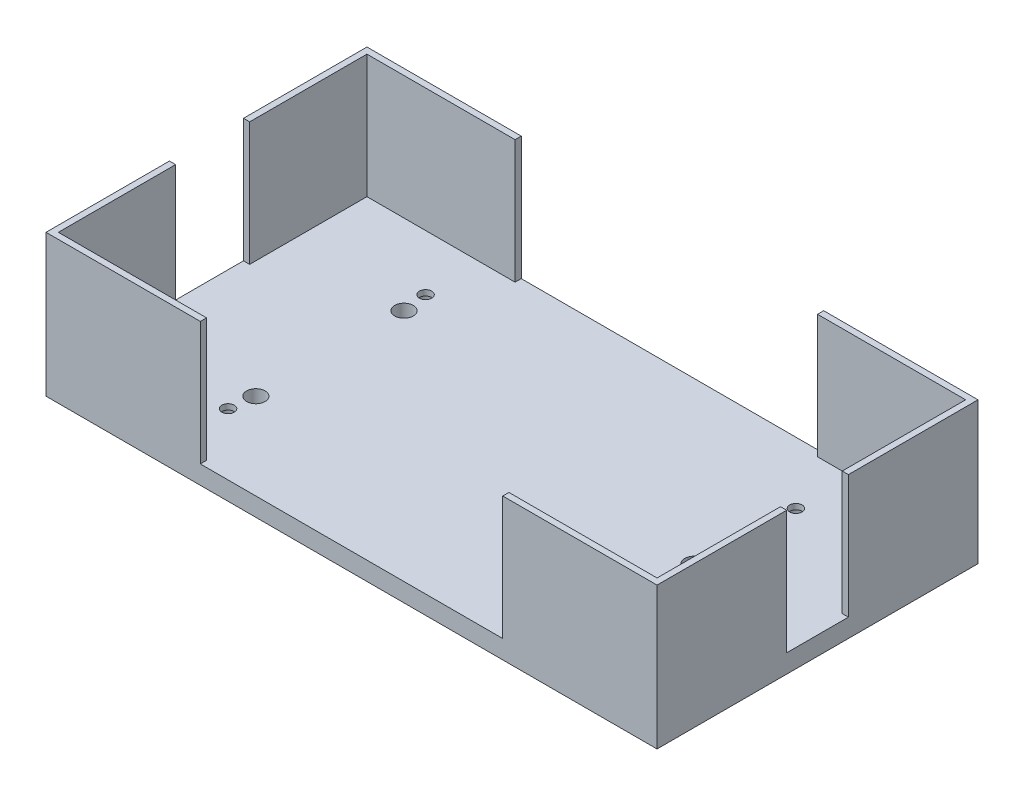
from build123d import *

# Parameters (mm, degrees)
SKETCH1_W           = 99
SKETCH1_H           = 52
BOSS_EXTRUDE1_DEPTH = 3
SKETCH5_R           = 1.5
CUT_EXTRUDE3_DEPTH  = 72.961470153
BOSS_EXTRUDE3_DEPTH = 20
SKETCH7_R           = 1
CUT_EXTRUDE4_DEPTH  = 75.628769162
SKETCH8_R           = 1.85
CUT_EXTRUDE5_DEPTH  = 2.1


with BuildPart() as part:
    # Sketch1 → Boss-Extrude1 (new body)
    with BuildSketch(Plane(origin=(0, 0, 0), x_dir=(1, 0, 0), z_dir=(0, 1, 0))):
        with Locations((-10.729105331, -13.267137121)):
            Rectangle(SKETCH1_W, SKETCH1_H)
    extrude(amount=BOSS_EXTRUDE1_DEPTH)

    # Sketch5 → Cut-Extrude3 (cut, through all)
    with BuildSketch(Plane(origin=(0, 3, 0), x_dir=(1, 0, 0), z_dir=(0, 1, 0))):
        with Locations((-40.229105331, -25.267137121)):
            Circle(SKETCH5_R)
        with Locations((-40.229105331, -1.267137121)):
            Circle(SKETCH5_R)
        with Locations((18.770894669, -13.267137121)):
            Circle(SKETCH5_R)
    extrude(amount=-CUT_EXTRUDE3_DEPTH, mode=Mode.SUBTRACT)

    # Sketch6 → Boss-Extrude3 (add)
    with BuildSketch(Plane(origin=(0, 3, 0), x_dir=(1, 0, 0), z_dir=(0, 1, 0))):
        Polygon((-60.229105331, -19.267137121), (-60.229105331, -39.267137121), (-35.229105331, -39.267137121), (-35.229105331, -38.267137121), (-59.229105331, -38.267137121), (-59.229105331, -19.267137121), align=None)
        Polygon((38.770894669, -18.267137121), (37.770894669, -18.267137121), (37.770894669, -38.267137121), (13.770894669, -38.267137121), (13.770894669, -39.267137121), (38.770894669, -39.267137121), align=None)
        Polygon((38.770894669, 12.732862879), (13.770894669, 12.732862879), (13.770894669, 11.732862879), (37.770894669, 11.732862879), (37.770894669, -8.267137121), (38.770894669, -8.267137121), align=None)
        Polygon((-60.229105331, -7.267137121), (-59.229105331, -7.267137121), (-59.229105331, 11.732862879), (-35.229105331, 11.732862879), (-35.229105331, 12.732862879), (-60.229105331, 12.732862879), align=None)
    extrude(amount=BOSS_EXTRUDE3_DEPTH)

    # Sketch7 → Cut-Extrude4 (cut, through all)
    with BuildSketch(Plane(origin=(0, 3, 0), x_dir=(1, 0, 0), z_dir=(0, 1, 0))):
        with Locations((19.270894669, -29.267137121)):
            Circle(SKETCH7_R)
        with Locations((-40.729105331, -29.267137121)):
            Circle(SKETCH7_R)
        with Locations((19.270894669, 2.732862879)):
            Circle(SKETCH7_R)
        with Locations((-40.729105331, 2.732862879)):
            Circle(SKETCH7_R)
    extrude(amount=-CUT_EXTRUDE4_DEPTH, mode=Mode.SUBTRACT)

    # Sketch8 → Cut-Extrude5 (cut)
    with BuildSketch(Plane(origin=(0, 0, 0), x_dir=(-1, 0, 0), z_dir=(0, -1, 0))):
        with Locations((-19.270894669, -29.267137121)):
            Circle(SKETCH8_R)
        with Locations((-19.270894669, 2.732862879)):
            Circle(SKETCH8_R)
        with Locations((40.729105331, -29.267137121)):
            Circle(SKETCH8_R)
        with Locations((40.729105331, 2.732862879)):
            Circle(SKETCH8_R)
    extrude(amount=-CUT_EXTRUDE5_DEPTH, mode=Mode.SUBTRACT)


solid = part.part
